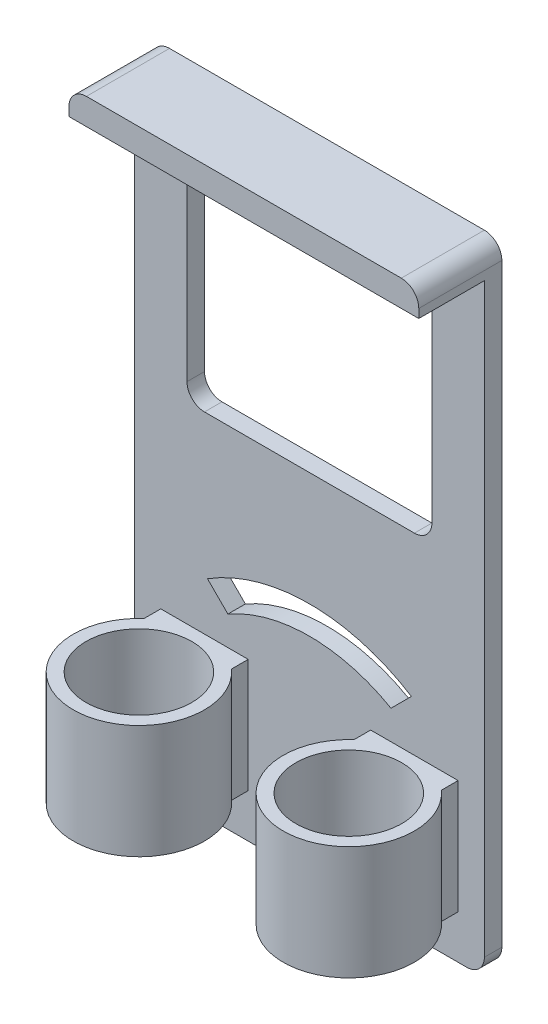
from build123d import *
from build123d.topology import SkipClean

# Parameters (mm, degrees)
SKETCH1_W                                    = 40
SKETCH1_H                                    = 40
BOSS_EXTRUDE2_DEPTH                          = 2
SKETCH2_W                                    = 6
SKETCH2_H                                    = 4
BOSS_EXTRUDE5_DEPTH                          = 3
SKETCH4_R                                    = 3.5
SKETCH4_R_2                                  = 1.6
BOSS_EXTRUDE6_DEPTH                          = 4
MIRROR2_AT_THE_SECOND_PLANE_COPY_1_SKETC_W   = 6
MIRROR2_AT_THE_SECOND_PLANE_COPY_1_SKETC_H   = 4
MIRROR2_AT_THE_SECOND_PLANE_COPY_1_DEPTH     = 3
MIRROR2_AT_THE_SECOND_PLANE_COPY_2_SKETC_R   = 3.5
MIRROR2_AT_THE_SECOND_PLANE_COPY_2_SKETC_R_2 = 1.6
MIRROR2_AT_THE_SECOND_PLANE_COPY_2_DEPTH     = 4
CUT_EXTRUDE2_DEPTH                           = 2
SKETCH8_R                                    = 1.6
CUT_EXTRUDE3_DEPTH                           = 2
SKETCH18_W                                   = 6
SKETCH18_H                                   = 2
BOSS_EXTRUDE10_DEPTH                         = 32
SKETCH19_W                                   = 40
SKETCH19_H                                   = 3.5
BOSS_EXTRUDE11_DEPTH                         = 3
FILLET1_R                                    = 2
SKETCH20_R                                   = 1.6
BOSS_EXTRUDE12_DEPTH                         = 10
SKETCH22_R                                   = 1.6
CUT_EXTRUDE4_DEPTH                           = 7
SKETCH23_R                                   = 6.05
BOSS_EXTRUDE14_DEPTH                         = 14
SKETCH21_R                                   = 1.6
CUT_EXTRUDE5_DEPTH                           = 10
CUT_EXTRUDE7_DEPTH                           = 22
BOSS_EXTRUDE18_DEPTH                         = 6
CUT_EXTRUDE9_DEPTH                           = 3
BOSS_EXTRUDE20_START                         = 2
SKETCH32_R                                   = 3.5
BOSS_EXTRUDE20_DEPTH                         = 2


with BuildPart() as part:
    # Sketch1 → Boss-Extrude2 (new body)
    with BuildSketch(Plane.XY):
        Rectangle(SKETCH1_W, SKETCH1_H)
    extrude(amount=BOSS_EXTRUDE2_DEPTH)

    # Sketch2 → Boss-Extrude5 (add)
    with BuildSketch(Plane.XY.offset(2)):
        with Locations((-12, 10)):
            Rectangle(SKETCH2_W, SKETCH2_H)
    boss_extrude5 = extrude(amount=BOSS_EXTRUDE5_DEPTH)

    # Sketch4 → Boss-Extrude6 (add)
    with BuildSketch(Plane(origin=(0, 12, 0), x_dir=(1, 0, 0), z_dir=(0, 1, 0))):
        with Locations((-12, -6.6)):
            Circle(SKETCH4_R)
        with Locations((-12, -6.6)):
            Circle(SKETCH4_R_2, mode=Mode.SUBTRACT)
    boss_extrude6 = extrude(amount=-BOSS_EXTRUDE6_DEPTH)

    # Mirror2: Boss-Extrude5, Boss-Extrude6 across plane
    add(boss_extrude5.mirror(Plane(origin=(0, 0, 0), x_dir=(0, 0, 1), z_dir=(1, 0, 0))))
    add(boss_extrude6.mirror(Plane(origin=(0, 0, 0), x_dir=(0, 0, 1), z_dir=(1, 0, 0))))

    # Mirror2 at the second plane: Boss-Extrude5, Boss-Extrude6 across plane
    add(boss_extrude5.mirror(Plane(origin=(0, 3, 0), x_dir=(0, 0, 1), z_dir=(0, -1, 0))))
    add(boss_extrude6.mirror(Plane(origin=(0, 3, 0), x_dir=(0, 0, 1), z_dir=(0, -1, 0))))

    # Mirror2 at the second plane copy 1 sketc → Mirror2 at the second plane copy 1 (add)
    with BuildSketch(Plane(origin=(0, 6, 2), x_dir=(-1, 0, 0), z_dir=(0, 0, 1))):
        with Locations((-12, 10)):
            Rectangle(MIRROR2_AT_THE_SECOND_PLANE_COPY_1_SKETC_W, MIRROR2_AT_THE_SECOND_PLANE_COPY_1_SKETC_H)
    extrude(amount=MIRROR2_AT_THE_SECOND_PLANE_COPY_1_DEPTH)

    # Mirror2 at the second plane copy 2 sketc → Mirror2 at the second plane copy 2 (add)
    with BuildSketch(Plane(origin=(0, -6, 0), x_dir=(-1, 0, 0), z_dir=(0, -1, 0))):
        with Locations((-12, -6.6)):
            Circle(MIRROR2_AT_THE_SECOND_PLANE_COPY_2_SKETC_R)
        with Locations((-12, -6.6)):
            Circle(MIRROR2_AT_THE_SECOND_PLANE_COPY_2_SKETC_R_2, mode=Mode.SUBTRACT)
    extrude(amount=-MIRROR2_AT_THE_SECOND_PLANE_COPY_2_DEPTH)

    # Sketch7 → Cut-Extrude2 (cut)
    with BuildSketch(Plane.XY.offset(2)):
        with BuildLine():
            ThreePointArc((-9.324585763, 1.324585763), (0, 3.8), (9.324585763, 1.324585763))
            Line((9.324585763, 1.324585763), (11.657506391, 3.657506391))
            ThreePointArc((11.657506391, 3.657506391), (0, 7), (-11.657506391, 3.657506391))
            Line((-11.657506391, 3.657506391), (-9.324585763, 1.324585763))
        make_face()
    extrude(amount=-CUT_EXTRUDE2_DEPTH, mode=Mode.SUBTRACT)

    # Sketch8 → Cut-Extrude3 (cut)
    with BuildSketch(Plane(origin=(0, 0, 0), x_dir=(-1, 0, 0), z_dir=(0, 0, -1))):
        with Locations((0, -10)):
            Circle(SKETCH8_R)
    extrude(amount=-CUT_EXTRUDE3_DEPTH, mode=Mode.SUBTRACT)

    # Sketch18 → Boss-Extrude10 (add)
    with BuildSketch(Plane(origin=(0, 20, 0), x_dir=(1, 0, 0), z_dir=(0, 1, 0))):
        with Locations((17, -1)):
            Rectangle(SKETCH18_W, SKETCH18_H)
        with Locations((-17, -1)):
            Rectangle(SKETCH18_W, SKETCH18_H)
    extrude(amount=BOSS_EXTRUDE10_DEPTH)

    # Sketch19 → Boss-Extrude11 (add)
    with BuildSketch(Plane(origin=(0, 52, 0), x_dir=(1, 0, 0), z_dir=(0, 1, 0))):
        with Locations((0, -1.75)):
            Rectangle(SKETCH19_W, SKETCH19_H)
    extrude(amount=-BOSS_EXTRUDE11_DEPTH)

    # Fillet1
    fillet1_edges = [part.edges().sort_by_distance(p)[0] for p in [
        (20, -20, 1),
        (-20, -20, 1),
        (-20, 52, 1.75),
        (20, 52, 1.75),
        (14, 20, 1),
        (-14, 20, 1),
        (-14, 49, 1),
        (14, 49, 1),
    ]]
    fillet(fillet1_edges, radius=FILLET1_R)

    # Sketch20 → Boss-Extrude12 (add)
    # profile 1 of 2: a face of its own
    with SkipClean():  # the faces are left unmerged after this step: merging them gives an invalid solid
        with BuildSketch(Plane.XZ.offset(6)):
            with BuildLine():
                Line((-9, 2), (-9, 4.797224362))
                ThreePointArc((-9, 4.797224362), (-12, 10.1), (-15, 4.797224362))
                Line((-15, 4.797224362), (-15, 2))
                Line((-15, 2), (-9, 2))
            make_face()
            with Locations((-12, 6.6)):
                Circle(SKETCH20_R, mode=Mode.SUBTRACT)
        # profile 2 of 2: a face of its own
        with BuildSketch(Plane.XZ.offset(6)):
            with BuildLine():
                Line((9, 4.797224362), (9, 2))
                Line((9, 2), (15, 2))
                Line((15, 2), (15, 4.797224362))
                ThreePointArc((15, 4.797224362), (12, 10.1), (9, 4.797224362))
            make_face()
            with Locations((12, 6.6)):
                Circle(SKETCH20_R, mode=Mode.SUBTRACT)
        extrude(amount=BOSS_EXTRUDE12_DEPTH)

    # Sketch22 → Cut-Extrude4 (cut)
    # profile 1 of 2: a face of its own
    with BuildSketch(Plane(origin=(0, -2, 0), x_dir=(1, 0, 0), z_dir=(0, 1, 0))):
        with BuildLine():
            Line((9, -2), (9, -4.797224362))
            ThreePointArc((9, -4.797224362), (12, -10.1), (15, -4.797224362))
            Line((15, -4.797224362), (15, -2))
            Line((15, -2), (9, -2))
        make_face()
        with Locations((12, -6.6)):
            Circle(SKETCH22_R, mode=Mode.SUBTRACT)
    # profile 2 of 2: a face of its own
    with BuildSketch(Plane(origin=(0, -2, 0), x_dir=(1, 0, 0), z_dir=(0, 1, 0))):
        with BuildLine():
            Line((-9, -4.797224362), (-9, -2))
            Line((-9, -2), (-15, -2))
            Line((-15, -2), (-15, -4.797224362))
            ThreePointArc((-15, -4.797224362), (-12, -10.1), (-9, -4.797224362))
        make_face()
        with Locations((-12, -6.6)):
            Circle(SKETCH22_R, mode=Mode.SUBTRACT)
    extrude(amount=-CUT_EXTRUDE4_DEPTH, mode=Mode.SUBTRACT)

    # Sketch23 → Boss-Extrude14 (add)
    # profile 1 of 2: a face of its own
    with BuildSketch(Plane.XZ.offset(16)):
        with BuildLine():
            Line((-7, 2), (-7, 3.909830056))
            ThreePointArc((-7, 3.909830056), (-12, 17), (-17, 3.909830056))
            Line((-17, 3.909830056), (-17, 2))
            Line((-17, 2), (-7, 2))
        make_face()
        with Locations((-12, 9.5)):
            Circle(SKETCH23_R, mode=Mode.SUBTRACT)
    # profile 2 of 2: a face of its own
    with BuildSketch(Plane.XZ.offset(16)):
        with BuildLine():
            Line((7, 2), (17, 2))
            Line((17, 2), (17, 3.909830056))
            ThreePointArc((17, 3.909830056), (12, 17), (7, 3.909830056))
            Line((7, 3.909830056), (7, 2))
        make_face()
        with Locations((12, 9.5)):
            Circle(SKETCH23_R, mode=Mode.SUBTRACT)
    extrude(amount=-BOSS_EXTRUDE14_DEPTH)

    # Sketch21 → Cut-Extrude5 (cut)
    # profile 1 of 2: a face of its own
    with BuildSketch(Plane(origin=(0, 12, 0), x_dir=(1, 0, 0), z_dir=(0, 1, 0))):
        with BuildLine():
            Line((9, -2), (9, -4.797224362))
            ThreePointArc((9, -4.797224362), (12, -10.1), (15, -4.797224362))
            Line((15, -4.797224362), (15, -2))
            Line((15, -2), (9, -2))
        make_face()
        with Locations((12, -6.6)):
            Circle(SKETCH21_R, mode=Mode.SUBTRACT)
    # profile 2 of 2: a face of its own
    with BuildSketch(Plane(origin=(0, 12, 0), x_dir=(1, 0, 0), z_dir=(0, 1, 0))):
        with BuildLine():
            Line((-9, -4.797224362), (-9, -2))
            Line((-9, -2), (-15, -2))
            Line((-15, -2), (-15, -4.797224362))
            ThreePointArc((-15, -4.797224362), (-12, -10.1), (-9, -4.797224362))
        make_face()
        with Locations((-12, -6.6)):
            Circle(SKETCH21_R, mode=Mode.SUBTRACT)
    extrude(amount=-CUT_EXTRUDE5_DEPTH, mode=Mode.SUBTRACT)

    # Sketch24 → Cut-Extrude7 (cut)
    with BuildSketch(Plane(origin=(0, -9, 0), x_dir=(1, 0, 0), z_dir=(0, 1, 0))):
        with BuildLine():
            Line((9, -4.246191857), (9, -4.797224362))
            ThreePointArc((9, -4.797224362), (12, -10.1), (15, -4.797224362))
            Line((15, -4.797224362), (15, -4.246191857))
            ThreePointArc((15, -4.246191857), (12, -3.45), (9, -4.246191857))
        make_face()
        with BuildLine():
            Line((-9, -4.797224362), (-9, -4.246191857))
            ThreePointArc((-9, -4.246191857), (-12, -3.45), (-15, -4.246191857))
            Line((-15, -4.246191857), (-15, -4.797224362))
            ThreePointArc((-15, -4.797224362), (-12, -10.1), (-9, -4.797224362))
        make_face()
    extrude(amount=-CUT_EXTRUDE7_DEPTH, mode=Mode.SUBTRACT)

    # Sketch31 → Boss-Extrude18 (add)
    with BuildSketch(Plane.XY.offset(3.5)):
        with BuildLine():
            Line((18, 52), (-18, 52))
            ThreePointArc((-18, 52), (-19.414213562, 51.414213562), (-20, 50))
            Line((-20, 50), (-20, 49))
            Line((-20, 49), (20, 49))
            Line((20, 49), (20, 50))
            ThreePointArc((20, 50), (19.414213562, 51.414213562), (18, 52))
        make_face()
    extrude(amount=BOSS_EXTRUDE18_DEPTH)

    # Sketch25 → Cut-Extrude9 (cut)
    with BuildSketch(Plane.XZ.offset(16)):
        with BuildLine():
            Line((-17, 2), (-7, 2))
            Line((-7, 2), (-7, 3.909830056))
            ThreePointArc((-7, 3.909830056), (-12, 17), (-17, 3.909830056))
            Line((-17, 3.909830056), (-17, 2))
        make_face()
        with BuildLine():
            Line((7, 3.909830056), (7, 2))
            Line((7, 2), (17, 2))
            Line((17, 2), (17, 3.909830056))
            ThreePointArc((17, 3.909830056), (12, 17), (7, 3.909830056))
        make_face()
    extrude(amount=-CUT_EXTRUDE9_DEPTH, mode=Mode.SUBTRACT)

    # Sketch32 → Boss-Extrude20 (add)
    # profile 1 of 2: a face of its own
    with BuildSketch(Plane.XZ.offset(13).offset(BOSS_EXTRUDE20_START)):
        with BuildLine():
            Line((-17, 3.909830056), (-17, 2))
            Line((-17, 2), (-7, 2))
            Line((-7, 2), (-7, 3.909830056))
            ThreePointArc((-7, 3.909830056), (-12, 17), (-17, 3.909830056))
        make_face()
        with Locations((-12, 9.5)):
            Circle(SKETCH32_R, mode=Mode.SUBTRACT)
    # profile 2 of 2: a face of its own
    with BuildSketch(Plane.XZ.offset(13).offset(BOSS_EXTRUDE20_START)):
        with BuildLine():
            Line((7, 3.909830056), (7, 2))
            Line((7, 2), (17, 2))
            Line((17, 2), (17, 3.909830056))
            ThreePointArc((17, 3.909830056), (12, 17), (7, 3.909830056))
        make_face()
        with Locations((12, 9.5)):
            Circle(SKETCH32_R, mode=Mode.SUBTRACT)
    extrude(amount=-BOSS_EXTRUDE20_DEPTH)


solid = part.part
